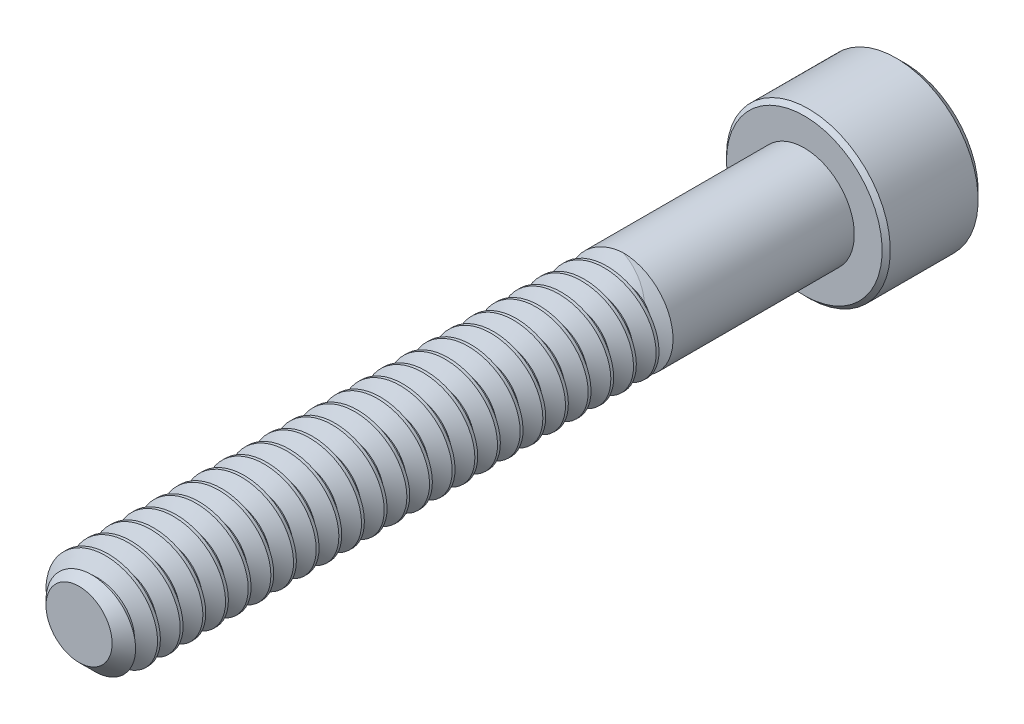
from build123d import *
from build123d.topology import SkipClean

# Parameters (mm, degrees)
SKETCH1_R          = 1.7526
EXTRUDE1_DEPTH     = 25.4
CHAMFER3_SIZE      = 0.5953125
CUT_SWEEP1_PITCH   = 0.79375
SKETCH6_R          = 2.8702
EXTRUDE2_DEPTH     = 3.5052
CUT_EXTRUDE1_DEPTH = 2.08359375
CHAMFER1_SIZE      = 0.28702
CHAMFER2_SIZE      = 0.14351


with BuildPart() as part:
    # Sketch1 → Extrude1 (new body)
    with BuildSketch(Plane.XY):
        Circle(SKETCH1_R)
    extrude(amount=-EXTRUDE1_DEPTH)

    # Chamfer3
    chamfer3_edges = [part.edges().sort_by_distance(p)[0] for p in [
        (-1.7526, 0, 0),
    ]]
    chamfer(chamfer3_edges, length=CHAMFER3_SIZE)

    # Cut-Sweep1: arcs per turn and ends read off the stored shape
    # Cut-Sweep1: the profile of Sketch3 profile screwed along a right-hand helix through 34 turns, 6 arcs to a turn; built about Z, then put on its axis
    cut_sweep1_z = Axis((0, 0, 0), (0, 0, 1))
    cut_sweep1_corners = [(1.7529, 0, -0.694704455), (1.237044252, 0, -0.396875), (1.237044252, 0, -0.29765625), (1.7529, 0, 0.000173205)]
    with BuildLine(mode=Mode.PRIVATE) as cut_sweep1_profile:
        Line(cut_sweep1_corners[0], cut_sweep1_corners[1])
        Line(cut_sweep1_corners[1], cut_sweep1_corners[2])
        Line(cut_sweep1_corners[2], cut_sweep1_corners[3])
        Line(cut_sweep1_corners[3], cut_sweep1_corners[0])
    cut_sweep1_cap = Face(cut_sweep1_profile.wire())
    cut_sweep1_turn_angles = [0, 30, 60, 90, 120, 150, 180, 210, 240, 270, 300, 330, 360]
    cut_sweep1_turn_weights = [1, 0.8660254037844387, 1, 0.8660254037844387, 1, 0.8660254037844387, 1, 0.8660254037844387, 1, 0.8660254037844387, 1, 0.8660254037844387, 1]
    cut_sweep1_turn_rails = [Edge.make_bspline([Vector(p[0], p[1], 0).rotate(cut_sweep1_z, cut_sweep1_turn_angles[k]) / cut_sweep1_turn_weights[k] + Vector(0, 0, p[2] + CUT_SWEEP1_PITCH * cut_sweep1_turn_angles[k] / 360) for k in range(13)], [0, 0, 0, 1, 1, 2, 2, 3, 3, 4, 4, 5, 5, 6, 6, 6], 2, cut_sweep1_turn_weights) for p in cut_sweep1_corners]
    cut_sweep1_turn_sides = [Face.make_surface_from_curves(cut_sweep1_turn_rails[p[0]], cut_sweep1_turn_rails[p[1]]) for p in [(0, 1), (1, 2), (2, 3), (3, 0)]]
    cut_sweep1 = Plane(origin=(0, 0, 0), x_dir=(0, 1, 0), z_dir=(0, 0, -1)) * Solid(Shell([*[p.moved(Location((0, 0, CUT_SWEEP1_PITCH * i))) for i in range(34) for p in cut_sweep1_turn_sides], cut_sweep1_cap, cut_sweep1_cap.rotate(cut_sweep1_z, 12240).moved(Location((0, 0, CUT_SWEEP1_PITCH * 12240 / 360)))]))
    add(cut_sweep1, mode=Mode.SUBTRACT)

    # Sketch5 → partially thread (revolve)
    with SkipClean():  # the faces are left unmerged after this step: merging them gives an invalid solid
        with BuildSketch(Plane(origin=(0, 0, 0), x_dir=(0, 0, -1), z_dir=(1, 0, 0)), mode=Mode.PRIVATE) as partially_thread_sk:
            Polygon((25.4, 1.7526), (19.05, 1.7526), (18.412105767, 0), (25.4, 0), align=None)
        revolve(partially_thread_sk.sketch.rotate(Axis((0, 0, 0), (0, 0, -1)), 270), axis=Axis((0, 0, 0), (0, 0, -1)))

    # Sketch6 → Extrude2 (add)
    with SkipClean():  # the faces are left unmerged after this step: merging them gives an invalid solid
        with BuildSketch(Plane(origin=(0, 0, -25.4), x_dir=(-1, 0, 0), z_dir=(0, 0, -1))):
            Circle(SKETCH6_R)
        extrude(amount=EXTRUDE2_DEPTH)
    add(part.part.scale(1), mode=Mode.REPLACE)  # the faces are merged on a copy

    # Sketch7 → Cut-Extrude1 (cut)
    with BuildSketch(Plane(origin=(0, 0, -28.9052), x_dir=(-1, 0, 0), z_dir=(0, 0, -1))):
        Polygon((0, 1.603951217), (-1.3890625, 0.801975608), (-1.3890625, -0.801975608), (0, -1.603951217), (1.3890625, -0.801975608), (1.3890625, 0.801975608), align=None)
    extrude(amount=-CUT_EXTRUDE1_DEPTH, mode=Mode.SUBTRACT)

    # Cut-Extrude2 cone 1 section (through the dimple's axis) → Cut-Extrude2 (revolve, cut)
    with BuildSketch(Plane(origin=(0, 0, -28.9052), x_dir=(0, 1, 0), z_dir=(1, 0, 0))):
        Polygon((0, 0), (1.603951217, 0), (0, 1.603951217), align=None)
    revolve(axis=Axis((0, 0, -28.9052), (0, 0, 1)), mode=Mode.SUBTRACT)

    # Chamfer1
    chamfer1_edges = [part.edges().sort_by_distance(p)[0] for p in [
        (2.8702, 0, -28.9052),
    ]]
    chamfer(chamfer1_edges, length=CHAMFER1_SIZE)

    # Chamfer2
    chamfer2_edges = [part.edges().sort_by_distance(p)[0] for p in [
        (2.8702, 0, -25.4),
    ]]
    chamfer(chamfer2_edges, length=CHAMFER2_SIZE)


solid = part.part
